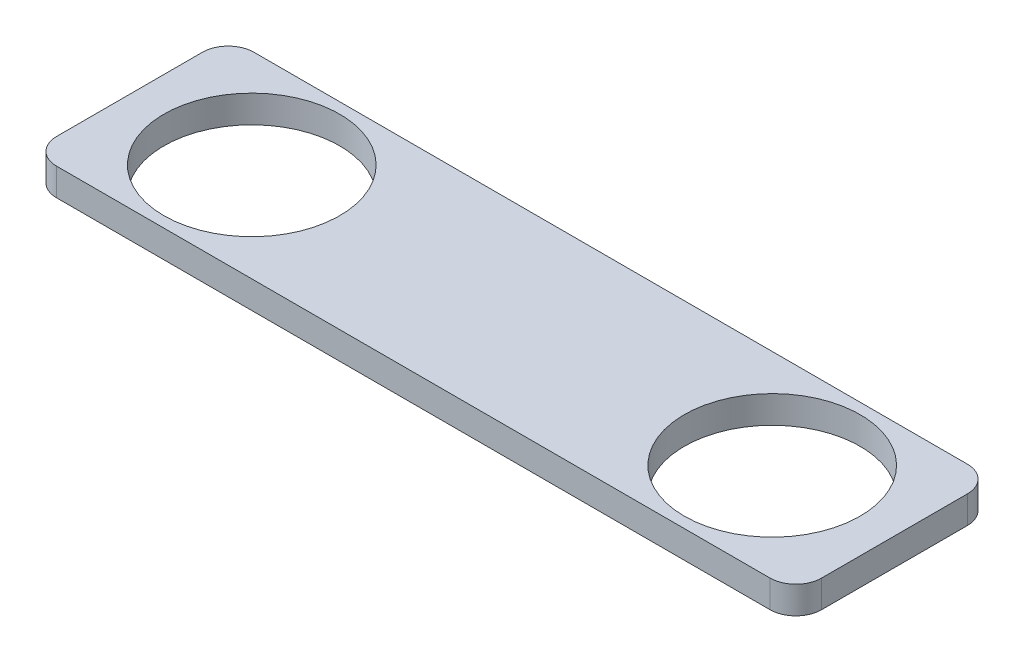
from build123d import *

# Parameters (mm, degrees)
SKETCH1_W           = 89.156
SKETCH1_H           = 23
SKETCH1_R           = 10.25
BOSS_EXTRUDE1_DEPTH = 3.2
FILLET1_R           = 3


with BuildPart() as part:
    # Sketch1 → Boss-Extrude1 (new body)
    with BuildSketch(Plane(origin=(0, 0, 0), x_dir=(1, 0, 0), z_dir=(0, 1, 0))):
        Rectangle(SKETCH1_W, SKETCH1_H)
        with Locations(Location((30.328, 0, 0), (0, 0, 270))):
            Circle(SKETCH1_R, mode=Mode.SUBTRACT)
        with Locations(Location((-30.328, 0, 0), (0, 0, 270))):
            Circle(SKETCH1_R, mode=Mode.SUBTRACT)
    extrude(amount=BOSS_EXTRUDE1_DEPTH)

    # Fillet1
    fillet1_edges = [part.edges().sort_by_distance(p)[0] for p in [
        (44.578, 1.6, -11.5),
        (44.578, 1.6, 11.5),
        (-44.578, 1.6, 11.5),
        (-44.578, 1.6, -11.5),
    ]]
    fillet(fillet1_edges, radius=FILLET1_R)


solid = part.part
